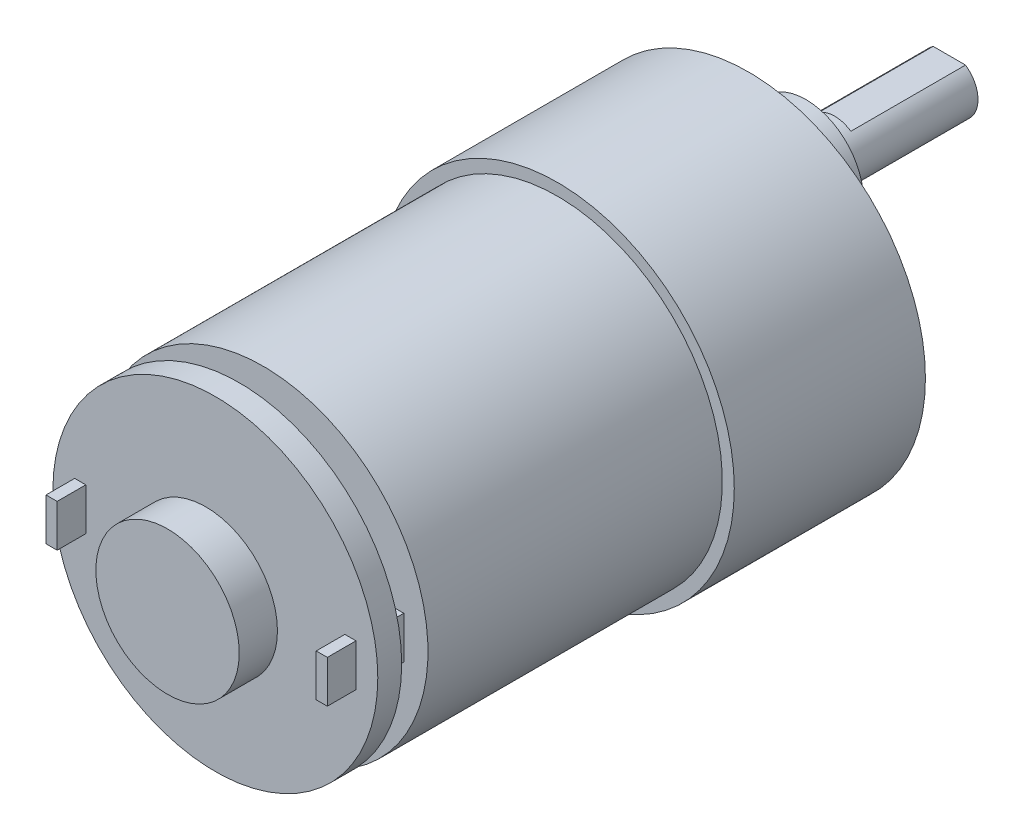
from build123d import *

# Parameters (mm, degrees)
SKETCH1_R            = 18.5
BOSS_EXTRUDE2_DEPTH  = 20
SKETCH2_R            = 17.25
BOSS_EXTRUDE3_DEPTH  = 30.8
SKETCH3_R            = 1.5
BOSS_EXTRUDE4_DEPTH  = 5
SKETCH5_W            = 1.164728471
SKETCH5_H            = 4.428190706
BOSS_EXTRUDE9_DEPTH  = 8
SKETCH6_R            = 6
BOSS_EXTRUDE12_DEPTH = 6
SKETCH9_R            = 3
BOSS_EXTRUDE13_DEPTH = 15
SKETCH10_W           = 6.033853608
SKETCH10_H           = 1
CUT_EXTRUDE1_DEPTH   = 12
SKETCH11_R           = 1.5
CUT_EXTRUDE4_DEPTH   = 5
CUT_EXTRUDE5_DEPTH   = 0.5
SKETCH13_R           = 17
BOSS_EXTRUDE14_DEPTH = 2.5
SKETCH15_R           = 1.489724088
BOSS_EXTRUDE16_DEPTH = 1
SKETCH16_R           = 7.5
BOSS_EXTRUDE17_DEPTH = 4


# Read off the part's stored shape, not the designer's step: moBlkMgr[GB37]
with BuildPart() as part:
    # Sketch1 → Boss-Extrude2 (new body)
    with BuildSketch(Plane.XY):
        Circle(SKETCH1_R)
    extrude(amount=-BOSS_EXTRUDE2_DEPTH)

    # Sketch2 → Boss-Extrude3 (add)
    with BuildSketch(Plane.XY):
        with Locations(Location((0, 0, 0), (0, 0, 180))):
            Circle(SKETCH2_R)
    extrude(amount=BOSS_EXTRUDE3_DEPTH)

    # Sketch3 → Boss-Extrude4 (add)
    with BuildSketch(Plane.XY.offset(30.8)):
        Circle(SKETCH3_R)
    extrude(amount=BOSS_EXTRUDE4_DEPTH)

    # Sketch5 → Boss-Extrude9 (add)
    with BuildSketch(Plane.XY.offset(30.8)):
        with Locations((14.135311547, 0)):
            Rectangle(SKETCH5_W, SKETCH5_H)
        with Locations((-14.135311547, 0)):
            Rectangle(SKETCH5_W, SKETCH5_H)
    extrude(amount=BOSS_EXTRUDE9_DEPTH)

    # Sketch6 → Boss-Extrude12 (add)
    with BuildSketch(Plane(origin=(0, 0, -20), x_dir=(-1, 0, 0), z_dir=(0, 0, -1))):
        with Locations(Location((0, 7, 0), (0, 0, 180))):
            Circle(SKETCH6_R)
    extrude(amount=BOSS_EXTRUDE12_DEPTH)

    # Sketch9 → Boss-Extrude13 (add)
    with BuildSketch(Plane(origin=(0, 0, -26), x_dir=(-1, 0, 0), z_dir=(0, 0, -1))):
        with Locations((0, 7)):
            Circle(SKETCH9_R)
    extrude(amount=BOSS_EXTRUDE13_DEPTH)

    # Sketch10 → Cut-Extrude1 (cut)
    with BuildSketch(Plane(origin=(0, 0, -41), x_dir=(-1, 0, 0), z_dir=(0, 0, -1))):
        with Locations((0, 9.974859546)):
            Rectangle(SKETCH10_W, SKETCH10_H)
    extrude(amount=-CUT_EXTRUDE1_DEPTH, mode=Mode.SUBTRACT)

    # Sketch11 → Cut-Extrude4 (cut)
    with BuildSketch(Plane(origin=(0, 0, -20), x_dir=(-1, 0, 0), z_dir=(0, 0, -1))):
        with Locations((7.75, 13.423393759)):
            Circle(SKETCH11_R)
        with Locations((15.5, 0)):
            Circle(SKETCH11_R)
        with Locations((7.75, -13.423393759)):
            Circle(SKETCH11_R)
        with Locations((0, -15.5)):
            Circle(SKETCH11_R)
        with Locations((-7.75, -13.423393759)):
            Circle(SKETCH11_R)
        with Locations((-15.5, 0)):
            Circle(SKETCH11_R)
        with Locations((-13.423393759, 7.75)):
            Circle(SKETCH11_R)
        with Locations((-7.75, 13.423393759)):
            Circle(SKETCH11_R)
        with Locations((13.423393759, 7.75)):
            Circle(SKETCH11_R)
    extrude(amount=-CUT_EXTRUDE4_DEPTH, mode=Mode.SUBTRACT)

    # Sketch12 → Cut-Extrude5 (cut)
    with BuildSketch(Plane(origin=(0, 0, -20), x_dir=(-1, 0, 0), z_dir=(0, 0, -1))):
        with BuildLine():
            ThreePointArc((-9.996975987, 5.233316288), (-0.033546899, -11.826522584), (9.929882188, 5.233316288))
            ThreePointArc((9.929882188, 5.233316288), (-0.033546899, -1.867556413), (-9.996975987, 5.233316288))
        make_face()
    extrude(amount=-CUT_EXTRUDE5_DEPTH, mode=Mode.SUBTRACT)

    # Sketch13 → Boss-Extrude14 (add)
    with BuildSketch(Plane.XY.offset(35.8)):
        Circle(SKETCH13_R)
    extrude(amount=-BOSS_EXTRUDE14_DEPTH)

    # Sketch15 → Boss-Extrude16 (add)
    with BuildSketch(Plane.XY.offset(35.8)):
        Circle(SKETCH15_R)
    extrude(amount=BOSS_EXTRUDE16_DEPTH)

    # Sketch16 → Boss-Extrude17 (add)
    with BuildSketch(Plane.XY.offset(36.8)):
        Circle(SKETCH16_R)
    extrude(amount=BOSS_EXTRUDE17_DEPTH)


solid = part.part
